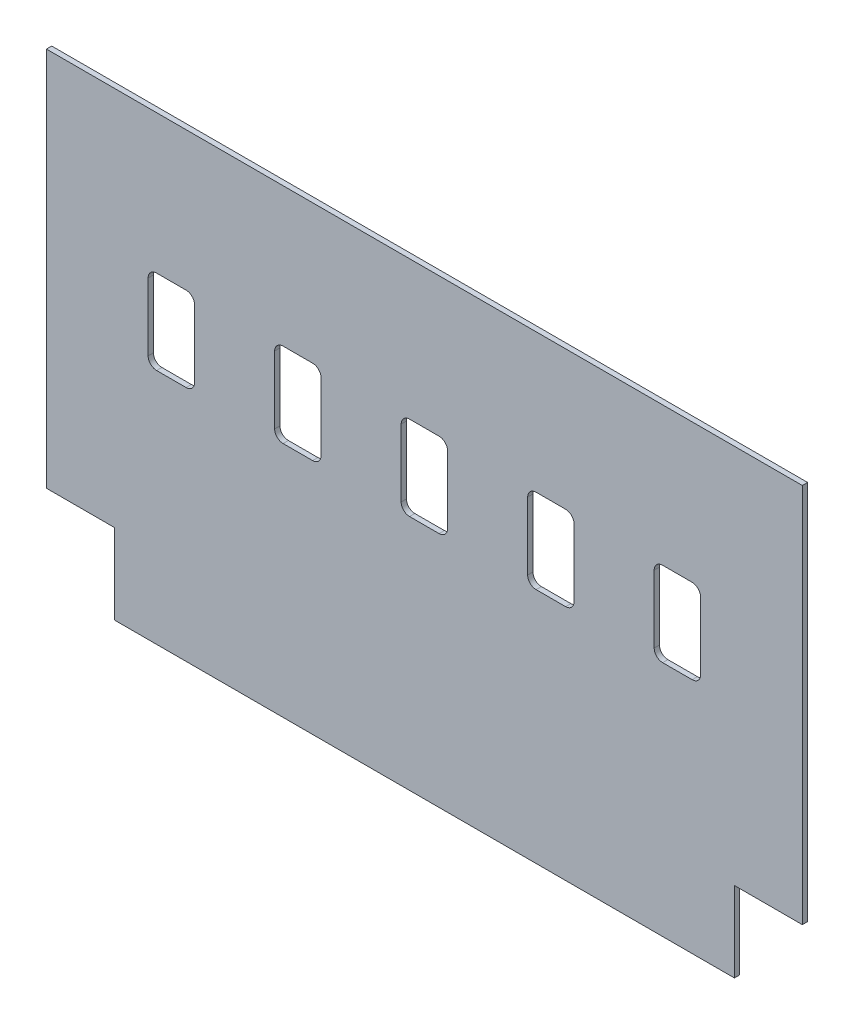
from build123d import *

# Parameters (mm, degrees)
SKETCH3_W           = 455.295
SKETCH3_H           = 277.368
BOSS_EXTRUDE1_DEPTH = 1.5875
CUT_EXTRUDE1_DEPTH  = 25.4
SKETCH8_W           = 40.894
SKETCH8_H           = 48.26
CUT_EXTRUDE2_DEPTH  = 25.4


with BuildPart() as part:
    # Sketch3 → Boss-Extrude1 (new, symmetric)
    with BuildSketch(Plane.XY):
        Rectangle(SKETCH3_W, SKETCH3_H)
    extrude(amount=BOSS_EXTRUDE1_DEPTH, both=True)

    # Sketch4 → Cut-Extrude1 (cut)
    with BuildSketch(Plane.XY.offset(1.5875)):
        with BuildLine():
            Line((-161.29, 54.991001016), (-143.51, 54.991001016))
            ThreePointArc((-143.51, 54.991001016), (-139.917897552, 53.503103464), (-138.43, 49.911001016))
            Line((-138.43, 49.911001016), (-138.43, 9.271001016))
            ThreePointArc((-138.43, 9.271001016), (-139.917897552, 5.678898568), (-143.51, 4.191001016))
            Line((-143.51, 4.191001016), (-161.29, 4.191001016))
            ThreePointArc((-161.29, 4.191001016), (-164.882102448, 5.678898568), (-166.37, 9.271001016))
            Line((-166.37, 9.271001016), (-166.37, 49.911001016))
            ThreePointArc((-166.37, 49.911001016), (-164.882102448, 53.503103464), (-161.29, 54.991001016))
        make_face()
        with BuildLine():
            Line((-8.89, 54.991001016), (8.89, 54.991001016))
            ThreePointArc((8.89, 54.991001016), (12.482102448, 53.503103464), (13.97, 49.911001016))
            Line((13.97, 49.911001016), (13.97, 9.271001016))
            ThreePointArc((13.97, 9.271001016), (12.482102448, 5.678898568), (8.89, 4.191001016))
            Line((8.89, 4.191001016), (-8.89, 4.191001016))
            ThreePointArc((-8.89, 4.191001016), (-12.482102448, 5.678898568), (-13.97, 9.271001016))
            Line((-13.97, 9.271001016), (-13.97, 49.911001016))
            ThreePointArc((-13.97, 49.911001016), (-12.482102448, 53.503103464), (-8.89, 54.991001016))
        make_face()
        with BuildLine():
            Line((67.31, 54.991001016), (85.09, 54.991001016))
            ThreePointArc((85.09, 54.991001016), (88.682102448, 53.503103464), (90.17, 49.911001016))
            Line((90.17, 49.911001016), (90.17, 9.271001016))
            ThreePointArc((90.17, 9.271001016), (88.682102448, 5.678898568), (85.09, 4.191001016))
            Line((85.09, 4.191001016), (67.31, 4.191001016))
            ThreePointArc((67.31, 4.191001016), (63.717897552, 5.678898568), (62.23, 9.271001016))
            Line((62.23, 9.271001016), (62.23, 49.911001016))
            ThreePointArc((62.23, 49.911001016), (63.717897552, 53.503103464), (67.31, 54.991001016))
        make_face()
        with BuildLine():
            Line((143.51, 54.991001016), (161.29, 54.991001016))
            ThreePointArc((161.29, 54.991001016), (164.882102448, 53.503103464), (166.37, 49.911001016))
            Line((166.37, 49.911001016), (166.37, 9.271001016))
            ThreePointArc((166.37, 9.271001016), (164.882102448, 5.678898568), (161.29, 4.191001016))
            Line((161.29, 4.191001016), (143.51, 4.191001016))
            ThreePointArc((143.51, 4.191001016), (139.917897552, 5.678898568), (138.43, 9.271001016))
            Line((138.43, 9.271001016), (138.43, 49.911001016))
            ThreePointArc((138.43, 49.911001016), (139.917897552, 53.503103464), (143.51, 54.991001016))
        make_face()
        with BuildLine():
            Line((-85.09, 54.991001016), (-67.31, 54.991001016))
            ThreePointArc((-67.31, 54.991001016), (-63.717897552, 53.503103464), (-62.23, 49.911001016))
            Line((-62.23, 49.911001016), (-62.23, 9.271001016))
            ThreePointArc((-62.23, 9.271001016), (-63.717897552, 5.678898568), (-67.31, 4.191001016))
            Line((-67.31, 4.191001016), (-85.09, 4.191001016))
            ThreePointArc((-85.09, 4.191001016), (-88.682102448, 5.678898568), (-90.17, 9.271001016))
            Line((-90.17, 9.271001016), (-90.17, 49.911001016))
            ThreePointArc((-90.17, 49.911001016), (-88.682102448, 53.503103464), (-85.09, 54.991001016))
        make_face()
    extrude(amount=-CUT_EXTRUDE1_DEPTH, mode=Mode.SUBTRACT)

    # Sketch8 → Cut-Extrude2 (cut)
    with BuildSketch(Plane.XY.offset(1.5875)):
        with Locations((-207.2005, -114.554)):
            Rectangle(SKETCH8_W, SKETCH8_H)
        with Locations((207.2005, -114.554)):
            Rectangle(SKETCH8_W, SKETCH8_H)
    extrude(amount=-CUT_EXTRUDE2_DEPTH, mode=Mode.SUBTRACT)


solid = part.part
